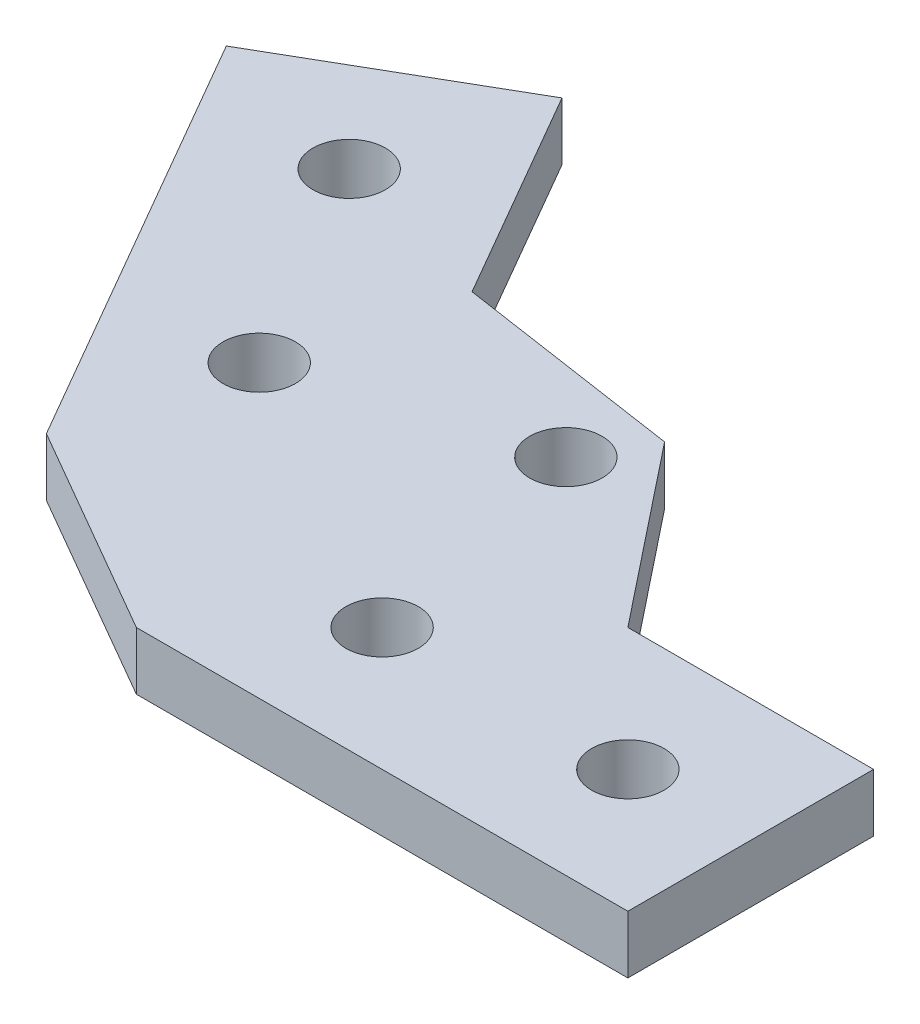
from build123d import *

# Parameters (mm, degrees)
SKETCH1_W           = 34
SKETCH1_H           = 17
SKETCH1_R           = 2.505
BOSS_EXTRUDE1_DEPTH = 4
BOSS_EXTRUDE2_DEPTH = 4
SKETCH13_R          = 2.505
BOSS_EXTRUDE3_DEPTH = 4


with BuildPart() as part:
    # sketch1 → Boss-Extrude1 (new body)
    with BuildSketch(Plane(origin=(0, 0, 0), x_dir=(1, 0, 0), z_dir=(0, 1, 0))):
        with Locations((17, -8.5)):
            Rectangle(SKETCH1_W, SKETCH1_H)
        with Locations((8.5, -8.5)):
            Circle(SKETCH1_R, mode=Mode.SUBTRACT)
        with Locations((25.5, -8.5)):
            Circle(SKETCH1_R, mode=Mode.SUBTRACT)
    extrude(amount=BOSS_EXTRUDE1_DEPTH)


with BuildPart() as body_2:
    # Mirror6: mirrored copy
    add(part.part.mirror(Plane(origin=(0, 0, 0), x_dir=(-0.49999999999999784, 0, 0.8660254037844399), z_dir=(-0.8660254037844399, 0, -0.49999999999999784))))


with BuildPart() as part_1:
    add(part.part)

    add(body_2.part)  # Boss-Extrude2 merges body 2
    # Sketch11 → Boss-Extrude2 (add)
    with BuildSketch(Plane(origin=(0, 0, 0), x_dir=(1, 0, 0), z_dir=(0, 1, 0))):
        Polygon((-14.722431864, -8.5), (0, -17), (0, 0), align=None)
    extrude(amount=BOSS_EXTRUDE2_DEPTH)

    # Sketch13 → Boss-Extrude3 (add)
    with BuildSketch(Plane(origin=(0, 0, 0), x_dir=(1, 0, 0), z_dir=(0, 1, 0))):
        Polygon((7.152847248, 12.389094852), (-8.5, 14.722431864), (0, 0), (17, 0), align=None)
        with Locations((4.652847248, 8.058967833)):
            Circle(SKETCH13_R, mode=Mode.SUBTRACT)
    extrude(amount=BOSS_EXTRUDE3_DEPTH)


solid = part_1.part
